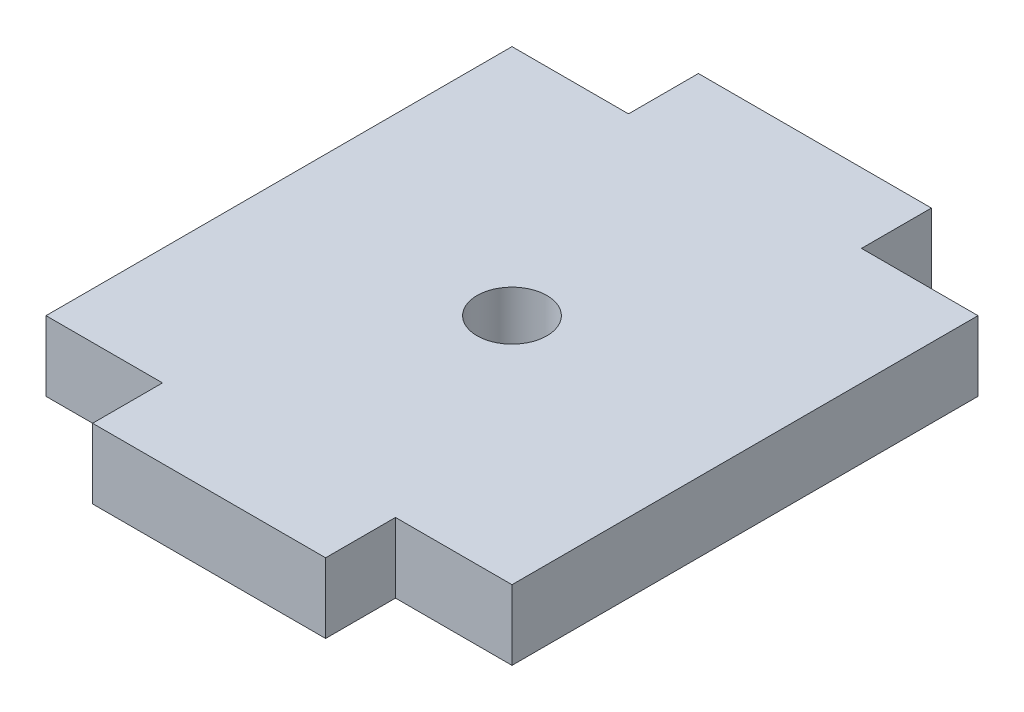
from build123d import *

# Parameters (mm, degrees)
SKETCH1_R           = 1.5
BOSS_EXTRUDE2_DEPTH = 3


with BuildPart() as part:
    # Sketch1 → Boss-Extrude2 (new body)
    with BuildSketch(Plane(origin=(0, 0, 0), x_dir=(1, 0, 0), z_dir=(0, 1, 0))):
        Polygon((15, 20), (20, 20), (20, 0), (15, 0), (15, -3), (5, -3), (5, 0), (0, 0), (0, 20), (5, 20), (5, 23), (15, 23), align=None)
        with Locations((10, 10)):
            Circle(SKETCH1_R, mode=Mode.SUBTRACT)
    extrude(amount=BOSS_EXTRUDE2_DEPTH)


solid = part.part
